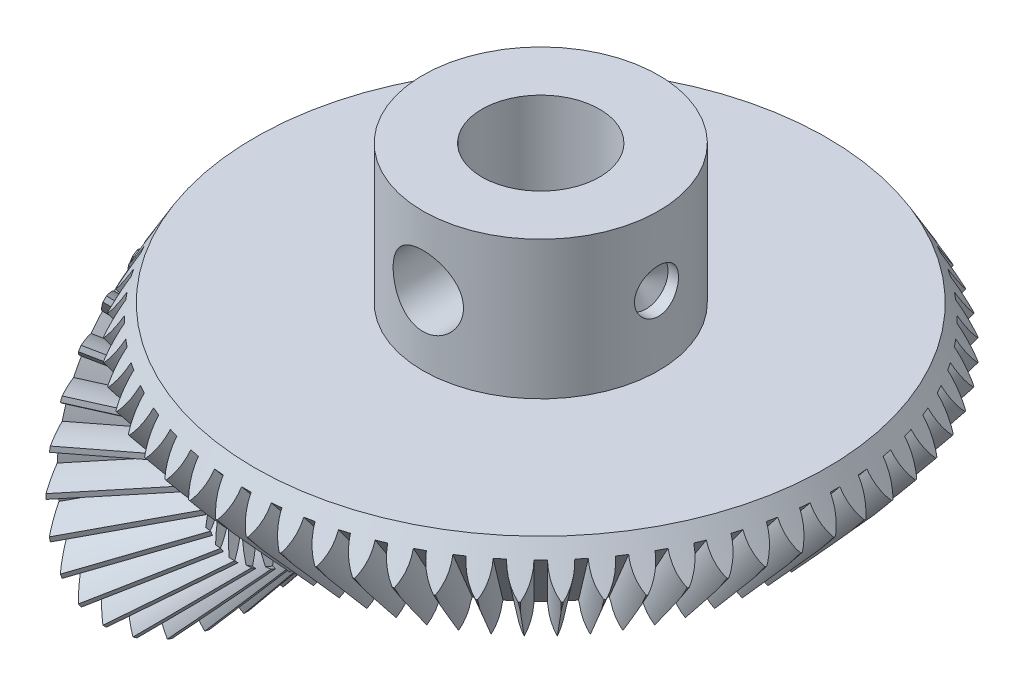
from build123d import *

# Parameters (mm, degrees)
CUT_EXTRUDE3_TEETH_START = -10
CUT_EXTRUDE3_TEETH_DEPTH = 38.647533478
CIRPATTERN1_COUNT        = 64
EXTRUDE1_TEETH_START     = -5.842
EXTRUDE1_TEETH_DEPTH     = 8.382
CIRPATTERN2_COUNT        = 32
SKETCH14_R               = 6.683507562
CUT_EXTRUDE1_DEPTH       = 5.588


with BuildPart() as part:
    # Sketch2 → Revolve1-LargestGear (revolve)
    with BuildSketch(Plane.XY):
        Polygon((-4.7625, 14.2748), (-2.37871, 14.2748), (-2.37871, 4.6228), (-9.216570266, 4.6228), (-9.754398022, 3.691255), (-12.51246088, 7.04215), (-11.56292176, 8.6868), (-4.7625, 8.6868), align=None)
    revolve(axis=Axis((0, 19.942137253, 0), (0, -1, 0)))

    # Sketch3 → Cut-Extrude3-Teeth (cut)
    with BuildSketch(Plane(origin=(-9.754398022, 3.691255, 0), x_dir=(0.7720995567395793, 0.6355015928245542, 0), z_dir=(0.6355015928245542, -0.7720995567395793, 0)).offset(CUT_EXTRUDE3_TEETH_START)):
        with BuildLine():
            ThreePointArc((-0.230362252, 0.797410795), (0.396516362, 0.357870894), (1.144573155, 0.194827479))
            ThreePointArc((1.144573155, 0.194827479), (1.143, 0), (1.144573155, -0.194827479))
            ThreePointArc((1.144573155, -0.194827479), (0.396516362, -0.357870894), (-0.230362252, -0.797410795))
            ThreePointArc((-0.230362252, -0.797410795), (-0.254, 0), (-0.230362252, 0.797410795))
        make_face()
    cut_extrude3_teeth = extrude(amount=CUT_EXTRUDE3_TEETH_DEPTH, mode=Mode.SUBTRACT)

    # CirPattern1: Cut-Extrude3-Teeth ×64 about axis
    cirpattern1_axis = Axis((0, 19.942137253, 0), (0, -1, 0))
    for i in range(1, CIRPATTERN1_COUNT):
        add(cut_extrude3_teeth.rotate(cirpattern1_axis, i * 360 / CIRPATTERN1_COUNT), mode=Mode.SUBTRACT)

    # Sketch10 → #4-40 Tapped Hole1 (revolve, cut)
    with BuildSketch(Plane(origin=(0, 11.4808, 2.54), x_dir=(0, 1, 0), z_dir=(1, 0, 0))):
        Polygon((0, 0), (0, 4.489152758), (1.1303, 3.81), (1.1303, 3.175), (1.4224, 3.175), (1.4224, 0), align=None)
    revolve(axis=Axis((0, 11.4808, -3.81), (0, 0, 1)), mode=Mode.SUBTRACT)

    # Sketch12 → #50 (0.07) Diameter Hole1 (revolve, cut)
    with BuildSketch(Plane(origin=(4.7625, 11.4808, 0), x_dir=(0, 0, -1), z_dir=(0, 1, 0))):
        Polygon((0, 0), (0, 1.04216509), (0.889, 0.508), (0.889, 0), align=None)
    revolve(axis=Axis((11.1125, 11.4808, 0), (-1, 0, 0)), mode=Mode.SUBTRACT)


with BuildPart() as body_2:
    # Sketch4 → Revolve2-SmallestGear (revolve)
    with BuildSketch(Plane.XY):
        Polygon((-12.51246088, 7.04215), (-9.754398022, 3.691255), (-10.292225779, 2.75971), (-10.292225779, 2.37871), (-19.05, 2.37871), (-19.05, 4.7625), (-13.462, 4.7625), (-13.462, 5.3975), align=None)
    revolve(axis=Axis((-20.225417933, 0, 0), (1, 0, 0)))

    # Sketch5 → Extrude1-Teeth (add)
    with BuildSketch(Plane(origin=(-9.754398022, 3.691255, 0), x_dir=(0.7720995567395793, 0.6355015928245542, 0), z_dir=(0.6355015928245542, -0.7720995567395793, 0)).offset(EXTRUDE1_TEETH_START)):
        with BuildLine():
            ThreePointArc((-1.249381011, 0), (-0.065317385, 0.331265488), (1.142572203, 0.1016))
            ThreePointArc((1.142572203, 0.1016), (1.143, 0), (1.142572203, -0.1016))
            ThreePointArc((1.142572203, -0.1016), (-0.065317385, -0.331265488), (-1.249381011, 0))
        make_face()
    extrude1_teeth = extrude(amount=EXTRUDE1_TEETH_DEPTH)

    # CirPattern2: Extrude1-Teeth ×32 about axis
    cirpattern2_axis = Axis((-20.225417933, 0, 0), (1, 0, 0))
    for i in range(1, CIRPATTERN2_COUNT):
        add(extrude1_teeth.rotate(cirpattern2_axis, i * 360 / CIRPATTERN2_COUNT))

    # Sketch6 → Cut-Revolve1 (revolve, cut)
    with BuildSketch(Plane.XY):
        Polygon((-13.462, 4.7625), (-13.462, 5.3975), (-11.56292176, 8.6868), (-4.7625, 8.6868), (-4.7625, 11.4808), (-19.05, 11.4808), (-19.05, 4.7625), align=None)
        Polygon((-19.05, 2.37871), (-19.05, 0), (0, 0), (0, 4.6228), (-9.216570266, 4.6228), (-10.292225779, 2.75971), (-10.292225779, 2.37871), align=None)
    revolve(axis=Axis((-20.225417933, 0, 0), (1, 0, 0)), mode=Mode.SUBTRACT)

    # Sketch14 → Cut-Extrude1 (cut)
    with BuildSketch(Plane.ZY.offset(19.05)):
        Circle(SKETCH14_R)
    extrude(amount=-CUT_EXTRUDE1_DEPTH, mode=Mode.SUBTRACT)


solid = Compound([part.part, body_2.part])
